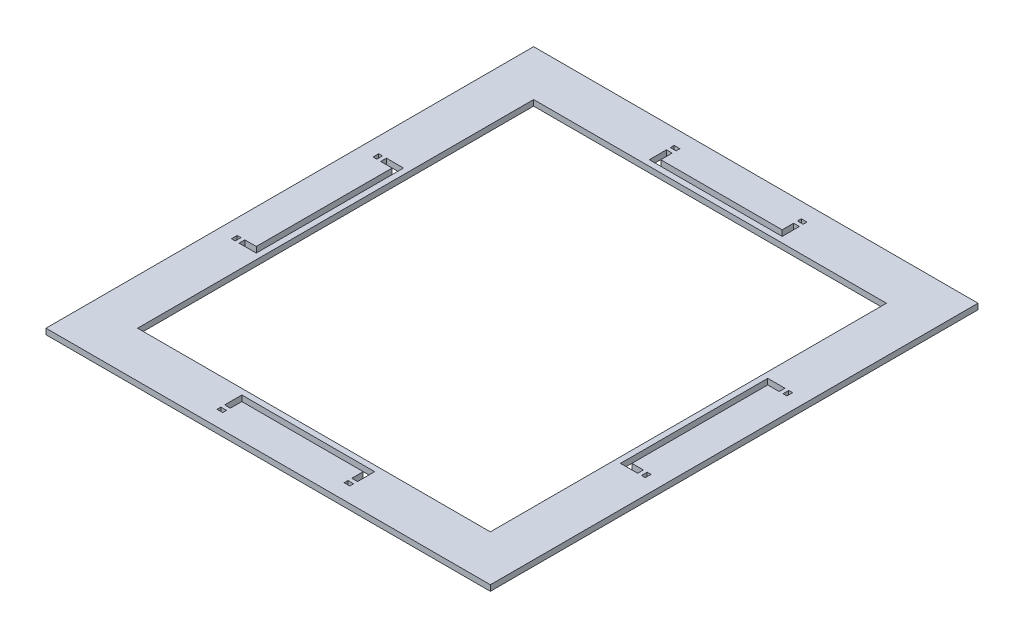
from build123d import *

# Parameters (mm, degrees)
SKETCH1_W                 = 2.116666666
SKETCH1_H                 = 3.175
SKETCH1_W_2               = 3.175
SKETCH1_H_2               = 2.116666666
BOSS_EXTRUDE1_DEPTH       = 3.175
SKETCH3_W                 = 3.175
SKETCH3_H                 = 3.175
SKETCH3_W_2               = 97.825
SKETCH3_H_2               = 109.825
BOSS_EXTRUDE2_DEPTH       = 3.175
MIRROR5_COPY_1_SKETCH_W   = 2.116666666
MIRROR5_COPY_1_SKETCH_H   = 3.175
MIRROR5_COPY_1_SKETCH_W_2 = 3.175
MIRROR5_COPY_1_SKETCH_H_2 = 2.116666666
MIRROR5_COPY_1_DEPTH      = 3.175
MIRROR5_COPY_2_SKETCH_W   = 3.175
MIRROR5_COPY_2_SKETCH_H   = 3.175
MIRROR5_COPY_2_SKETCH_W_2 = 97.825
MIRROR5_COPY_2_SKETCH_H_2 = 109.825
MIRROR5_COPY_2_DEPTH      = 3.175
MIRROR5_COPY_3_SKETCH_W   = 2.116666666
MIRROR5_COPY_3_SKETCH_H   = 3.175
MIRROR5_COPY_3_SKETCH_W_2 = 3.175
MIRROR5_COPY_3_SKETCH_H_2 = 2.116666666
MIRROR5_COPY_3_DEPTH      = 3.175
MIRROR5_COPY_4_SKETCH_W   = 3.175
MIRROR5_COPY_4_SKETCH_H   = 3.175
MIRROR5_COPY_4_SKETCH_W_2 = 97.825
MIRROR5_COPY_4_SKETCH_H_2 = 109.825
MIRROR5_COPY_4_DEPTH      = 3.175


with BuildPart() as part:
    # Sketch1 → Boss-Extrude1 (new body)
    with BuildSketch(Plane(origin=(0, 0, 0), x_dir=(1, 0, 0), z_dir=(0, 1, 0))):
        Polygon((0, 135.225), (-123.225, 135.225), (-123.225, 0), (-104.175, 0), (-104.175, 37.666666667), (-110.525, 37.666666667), (-110.525, 40.841666667), (-101, 40.841666667), (-101, 113), (-36.841666667, 113), (-36.841666667, 122.525), (-33.666666667, 122.525), (-33.666666667, 116.175), (0, 116.175), align=None)
        with Locations((-113.7, 39.254166667)):
            Rectangle(SKETCH1_W, SKETCH1_H, mode=Mode.SUBTRACT)
        with Locations((-35.254166667, 125.7)):
            Rectangle(SKETCH1_W_2, SKETCH1_H_2, mode=Mode.SUBTRACT)
    boss_extrude1 = extrude(amount=BOSS_EXTRUDE1_DEPTH)

    # Sketch3 → Boss-Extrude2 (add)
    with BuildSketch(Plane(origin=(0, 3.175, 0), x_dir=(1, 0, 0), z_dir=(0, 1, 0))):
        with Locations((-99.4125, 111.4125)):
            Rectangle(SKETCH3_W, SKETCH3_H)
        with Locations((-48.9125, 111.4125)):
            Rectangle(SKETCH3_W_2, SKETCH3_H)
        with Locations((-99.4125, 54.9125)):
            Rectangle(SKETCH3_W, SKETCH3_H_2)
    boss_extrude2 = extrude(amount=-BOSS_EXTRUDE2_DEPTH)

    # Mirror4: Boss-Extrude1, Boss-Extrude2 across plane
    add(boss_extrude1.mirror(Plane(origin=(0, 0, 0), x_dir=(0, 0, 1), z_dir=(1, 0, 0))))
    add(boss_extrude2.mirror(Plane(origin=(0, 0, 0), x_dir=(0, 0, 1), z_dir=(1, 0, 0))))

    # Mirror5 copy 1 sketch → Mirror5 copy 1 (add)
    with BuildSketch(Plane(origin=(0, 0, 0), x_dir=(-1, 0, 0), z_dir=(0, 1, 0))):
        Polygon((0, 135.225), (-123.225, 135.225), (-123.225, 0), (-104.175, 0), (-104.175, 37.666666667), (-110.525, 37.666666667), (-110.525, 40.841666667), (-101, 40.841666667), (-101, 113), (-36.841666667, 113), (-36.841666667, 122.525), (-33.666666667, 122.525), (-33.666666667, 116.175), (0, 116.175), align=None)
        with Locations((-113.7, 39.254166667)):
            Rectangle(MIRROR5_COPY_1_SKETCH_W, MIRROR5_COPY_1_SKETCH_H, mode=Mode.SUBTRACT)
        with Locations((-35.254166667, 125.7)):
            Rectangle(MIRROR5_COPY_1_SKETCH_W_2, MIRROR5_COPY_1_SKETCH_H_2, mode=Mode.SUBTRACT)
    extrude(amount=MIRROR5_COPY_1_DEPTH)

    # Mirror5 copy 2 sketch → Mirror5 copy 2 (add)
    with BuildSketch(Plane(origin=(0, 3.175, 0), x_dir=(-1, 0, 0), z_dir=(0, 1, 0))):
        with Locations((-99.4125, 111.4125)):
            Rectangle(MIRROR5_COPY_2_SKETCH_W, MIRROR5_COPY_2_SKETCH_H)
        with Locations((-48.9125, 111.4125)):
            Rectangle(MIRROR5_COPY_2_SKETCH_W_2, MIRROR5_COPY_2_SKETCH_H)
        with Locations((-99.4125, 54.9125)):
            Rectangle(MIRROR5_COPY_2_SKETCH_W, MIRROR5_COPY_2_SKETCH_H_2)
    extrude(amount=-MIRROR5_COPY_2_DEPTH)

    # Mirror5 copy 3 sketch → Mirror5 copy 3 (add)
    with BuildSketch(Plane(origin=(0, 0, 0), x_dir=(1, 0, 0), z_dir=(0, 1, 0))):
        Polygon((0, -135.225), (-123.225, -135.225), (-123.225, 0), (-104.175, 0), (-104.175, -37.666666667), (-110.525, -37.666666667), (-110.525, -40.841666667), (-101, -40.841666667), (-101, -113), (-36.841666667, -113), (-36.841666667, -122.525), (-33.666666667, -122.525), (-33.666666667, -116.175), (0, -116.175), align=None)
        with Locations((-113.7, -39.254166667)):
            Rectangle(MIRROR5_COPY_3_SKETCH_W, MIRROR5_COPY_3_SKETCH_H, mode=Mode.SUBTRACT)
        with Locations((-35.254166667, -125.7)):
            Rectangle(MIRROR5_COPY_3_SKETCH_W_2, MIRROR5_COPY_3_SKETCH_H_2, mode=Mode.SUBTRACT)
    extrude(amount=MIRROR5_COPY_3_DEPTH)

    # Mirror5 copy 4 sketch → Mirror5 copy 4 (add)
    with BuildSketch(Plane(origin=(0, 3.175, 0), x_dir=(1, 0, 0), z_dir=(0, 1, 0))):
        with Locations((-99.4125, -111.4125)):
            Rectangle(MIRROR5_COPY_4_SKETCH_W, MIRROR5_COPY_4_SKETCH_H)
        with Locations((-48.9125, -111.4125)):
            Rectangle(MIRROR5_COPY_4_SKETCH_W_2, MIRROR5_COPY_4_SKETCH_H)
        with Locations((-99.4125, -54.9125)):
            Rectangle(MIRROR5_COPY_4_SKETCH_W, MIRROR5_COPY_4_SKETCH_H_2)
    extrude(amount=-MIRROR5_COPY_4_DEPTH)


solid = part.part
